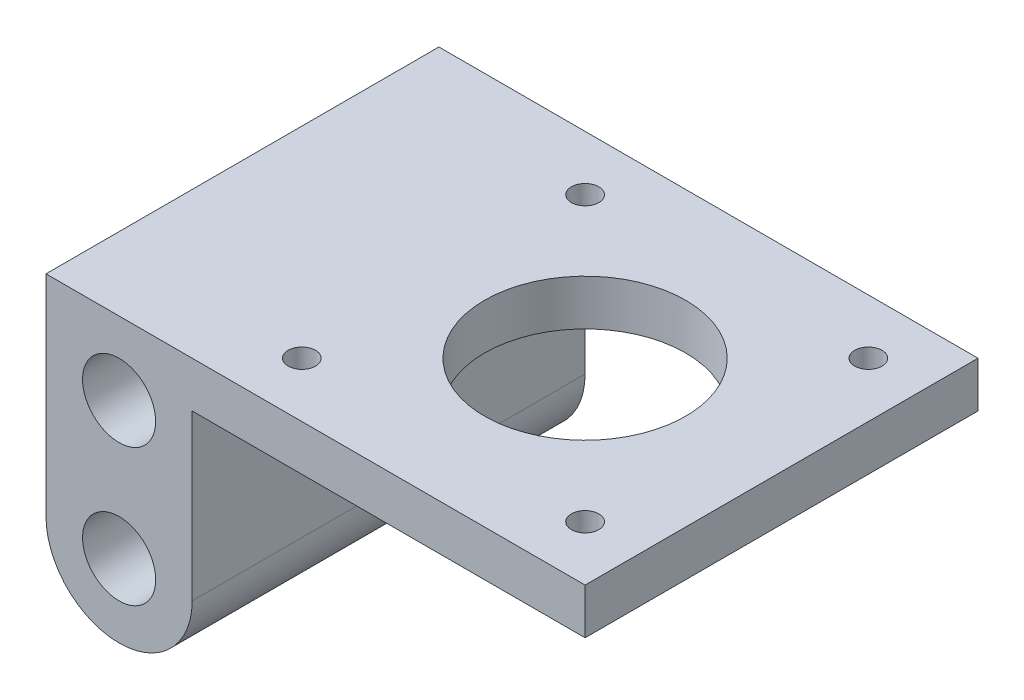
from build123d import *

# Parameters (mm, degrees)
SKETCH1_R           = 4
BOSS_EXTRUDE1_DEPTH = 43
SKETCH2_R           = 11
SKETCH2_R_2         = 1.5
CUT_EXTRUDE1_DEPTH  = 73.360869254


with BuildPart() as part:
    # Sketch1 → Boss-Extrude1 (new body)
    with BuildSketch(Plane.XY):
        with BuildLine():
            Line((-9.744590154, 5.930433006), (-9.744590154, -17.069566994))
            ThreePointArc((-9.744590154, -17.069566994), (-1.744590154, -25.069566994), (6.255409846, -17.069566994))
            Line((6.255409846, -17.069566994), (6.255409846, 0.930433006))
            Line((6.255409846, 0.930433006), (49.255409846, 0.930433006))
            Line((49.255409846, 0.930433006), (49.255409846, 5.930433006))
            Line((49.255409846, 5.930433006), (-9.744590154, 5.930433006))
        make_face()
        with Locations((-1.744590154, -17.069566994)):
            Circle(SKETCH1_R, mode=Mode.SUBTRACT)
        with Locations((-1.744590154, -2.069566994)):
            Circle(SKETCH1_R, mode=Mode.SUBTRACT)
    extrude(amount=-BOSS_EXTRUDE1_DEPTH)

    # Sketch2 → Cut-Extrude1 (cut, through all)
    with BuildSketch(Plane(origin=(0, 5.930433006, 0), x_dir=(1, 0, 0), z_dir=(0, 1, 0))):
        with Locations((27.755409846, 21.5)):
            Circle(SKETCH2_R)
        with Locations((43.255409846, 37)):
            Circle(SKETCH2_R_2)
        with Locations((12.255409846, 37)):
            Circle(SKETCH2_R_2)
        with Locations((12.255409846, 6)):
            Circle(SKETCH2_R_2)
        with Locations((43.255409846, 6)):
            Circle(SKETCH2_R_2)
    extrude(amount=-CUT_EXTRUDE1_DEPTH, mode=Mode.SUBTRACT)


solid = part.part
